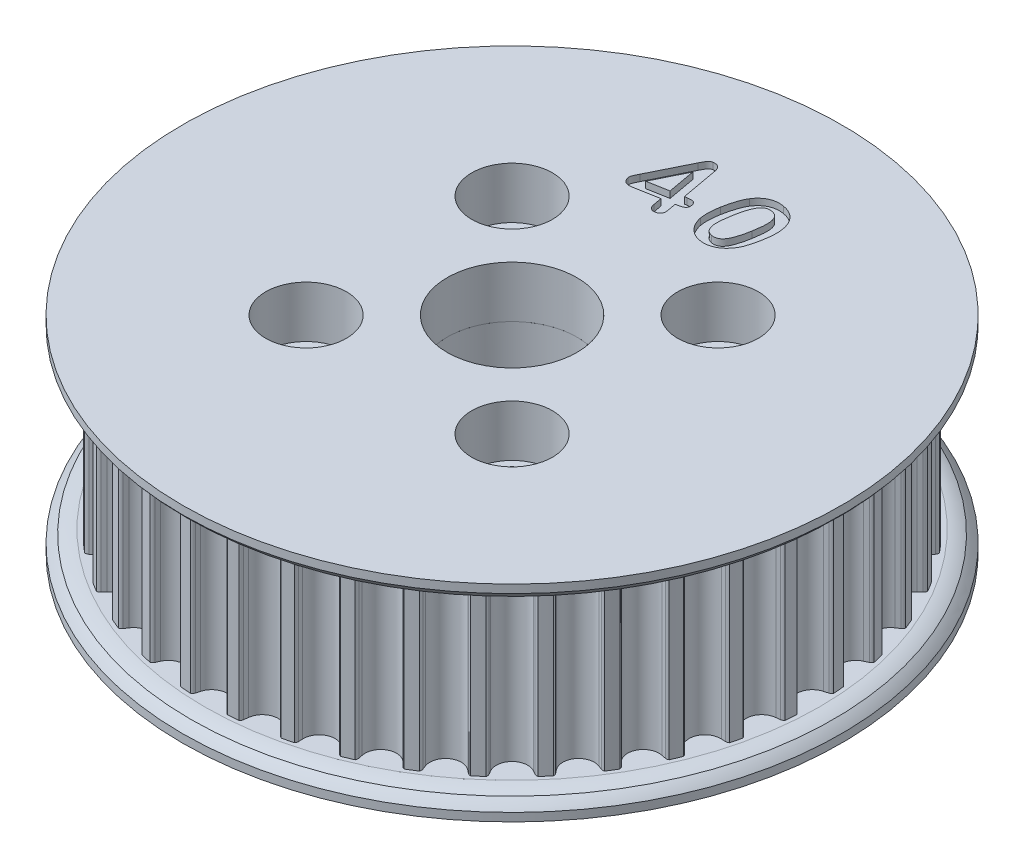
from build123d import *

# Parameters (mm, degrees)
SKETCH1_R                    = 18.717593782
TOOTHOD_DEPTH                = 5.08
TOOTHPROFILE_DEPTH           = 27.953720225
TOOTHPATTERN_COUNT           = 40
LARGE_TOOTH_COUNT_DEPTH      = 32.418064867
LARGE_TOOTH_COUNT_DEPTH_BACK = 0.4
CUT_EXTRUDE1_DEPTH           = 9.525
SKETCH15_R                   = 4
BOSS_EXTRUDE1_DEPTH          = 9.525
SKETCH16_R                   = 4
SKETCH16_R_2                 = 2.4892
CUT_EXTRUDE2_DEPTH           = 32.418064997
SKETCH17_R                   = 2.0193
CUT_EXTRUDE3_DEPTH           = 31.274253635
CIRPATTERN1_START            = -6.35
CIRPATTERN1_OUTLINE_R        = 2.0193
CIRPATTERN1_DEPTH            = 12.7
CIRPATTERN1_START_2          = 3.175
CIRPATTERN1_2_OUTLINE_R      = 2.4892
CIRPATTERN1_2_OUTLINE_R_2    = 2.0193
CIRPATTERN1_2_DEPTH          = 3.175


# Read off the part's stored shape, not the designer's step: CirPattern1
with BuildPart() as part:
    # Sketch1 → ToothOD (new, symmetric)
    with BuildSketch(Plane(origin=(0, 0, 0), x_dir=(1, 0, 0), z_dir=(0, 1, 0))):
        with Locations(Location((0, 0, 0), (0, 0, 270))):
            Circle(SKETCH1_R)
    extrude(amount=TOOTHOD_DEPTH, both=True)

    # Sketch2 → ToothProfile (cut, symmetric)
    with BuildSketch(Plane(origin=(0, 0, 0), x_dir=(1, 0, 0), z_dir=(0, 1, 0))):
        with BuildLine():
            ThreePointArc((-0.937033068, 18.267655778), (-0.590385173, 17.749481168), (0, 17.549193782))
            ThreePointArc((0, 17.549193782), (0.590385173, 17.749481168), (0.937033068, 18.267655778))
            ThreePointArc((0.937033068, 18.267655778), (0.971699064, 18.39376724), (1.007805813, 18.519473782))
            ThreePointArc((1.007805813, 18.519473782), (1.053477193, 18.612017257), (1.127830075, 18.68358414))
            ThreePointArc((1.127830075, 18.68358414), (0, 18.717593782), (-1.127830075, 18.68358414))
            ThreePointArc((-1.127830075, 18.68358414), (-1.053477193, 18.612017257), (-1.007805813, 18.519473782))
            ThreePointArc((-1.007805813, 18.519473782), (-0.971699064, 18.39376724), (-0.937033068, 18.267655778))
        make_face()
    toothprofile = extrude(amount=TOOTHPROFILE_DEPTH, both=True, mode=Mode.SUBTRACT)

    # ToothPattern: ToothProfile ×40 about axis
    toothpattern_axis = Axis((0, 0, 0), (0, 1, 0))
    for i in range(1, TOOTHPATTERN_COUNT):
        add(toothprofile.rotate(toothpattern_axis, i * 360 / TOOTHPATTERN_COUNT), mode=Mode.SUBTRACT)

    # Sketch4 → Flange (revolve)
    with BuildSketch(Plane.XY, mode=Mode.PRIVATE) as flange_sk:
        with BuildLine():
            Line((0, -5.08), (18.971593782, -5.08))
            ThreePointArc((18.971593782, -5.08), (19.402795588, -5.170608766), (19.812, -5.334))
            ThreePointArc((19.812, -5.334), (20.080284982, -5.573715018), (20.32, -5.842))
            Line((20.32, -5.842), (20.32, -6.35))
            Line((20.32, -6.35), (0, -6.35))
            Line((0, -6.35), (0, -5.08))
        make_face()
        with BuildLine():
            Line((20.32, 6.35), (20.32, 5.842))
            ThreePointArc((20.32, 5.842), (20.080284982, 5.573715018), (19.812, 5.334))
            ThreePointArc((19.812, 5.334), (19.402795588, 5.170608766), (18.971593782, 5.08))
            Line((18.971593782, 5.08), (0, 5.08))
            Line((0, 5.08), (0, 6.35))
            Line((0, 6.35), (20.32, 6.35))
        make_face()
    revolve(flange_sk.sketch.rotate(Axis((0, 8.73125, 0), (0, -1, 0)), 90), axis=Axis((0, 8.73125, 0), (0, -1, 0)))

    # Sketch9 → Large Tooth Count (cut, two sides: drawn at the far end of the back side and taken through both)
    # profile 1 of 2: a face of its own
    with BuildSketch(Plane(origin=(0, 6.35, 0), x_dir=(1, 0, 0), z_dir=(0, 1, 0)).offset(-LARGE_TOOTH_COUNT_DEPTH_BACK)):
        with BuildLine():
            Line((-1.531001416, 10.273963423), (-1.62833501, 10.808851704))
            Line((-1.62833501, 10.808851704), (-3.113342041, 10.538282173))
            add(Edge.make_bspline(
                [(-3.113342041, 10.538282173), (-3.157573868, 10.531489763), (-3.240725954, 10.518720609), (-3.360934072, 10.522196405), (-3.467169088, 10.543479268), (-3.559107996, 10.585122259), (-3.634516906, 10.645268103), (-3.693830465, 10.721045004), (-3.73878313, 10.810870646), (-3.753830455, 10.877741788), (-3.761637354, 10.912436079)],
                knots=[0, 0, 0, 0, 1.261064791, 2.370694921, 3.375971367, 4.300849758, 5.191864173, 6.071073382, 6.999228387, 8, 8, 8, 8], degree=3))
            add(Edge.make_bspline(
                [(-3.761637354, 10.912436079), (-3.764103905, 10.931753989), (-3.769109177, 10.970955045), (-3.763805913, 11.032622419), (-3.747957436, 11.09727573), (-3.722649369, 11.164950071), (-3.691299777, 11.233538807), (-3.658266667, 11.30528234), (-3.618789811, 11.38274981), (-3.591055139, 11.437787787), (-3.575899854, 11.467862642)],
                knots=[0, 0, 0, 0, 0.783109992, 1.589133624, 2.47665684, 3.459593021, 4.496192511, 5.515924219, 6.642606049, 8, 8, 8, 8], degree=3))
            Line((-3.575899854, 11.467862642), (-2.390930323, 13.862804829))
            add(Edge.make_bspline(
                [(-2.390930323, 13.862804829), (-2.372748074, 13.899557905), (-2.338615998, 13.968551508), (-2.28677642, 14.063091234), (-2.239840673, 14.142624748), (-2.196501784, 14.208547826), (-2.15133101, 14.262696412), (-2.097029316, 14.301690828), (-2.037496406, 14.332917348), (-1.993600767, 14.342701585), (-1.97123501, 14.34768686)],
                knots=[0, 0, 0, 0, 1.473715082, 2.766487129, 3.87475664, 4.791697709, 5.602923368, 6.390376914, 7.179862975, 8, 8, 8, 8], degree=3))
            add(Edge.make_bspline(
                [(-1.97123501, 14.34768686), (-1.93560088, 14.353037021), (-1.867972069, 14.363190911), (-1.769708494, 14.354811035), (-1.68199654, 14.329147171), (-1.605665982, 14.283144549), (-1.541717762, 14.217459864), (-1.491172292, 14.133016218), (-1.450453439, 14.031118428), (-1.434266071, 13.95571375), (-1.425631104, 13.915489985)],
                knots=[0, 0, 0, 0, 1.082605443, 2.054640314, 2.945534019, 3.814624522, 4.708898043, 5.679607825, 6.762213268, 8, 8, 8, 8], degree=3))
            Line((-1.425631104, 13.915489985), (-1.010400635, 11.629489985))
            Line((-1.010400635, 11.629489985), (-0.882706104, 11.652707173))
            add(Edge.make_bspline(
                [(-0.882706104, 11.652707173), (-0.84646646, 11.658246344), (-0.777505328, 11.668786941), (-0.677916966, 11.676404796), (-0.588147993, 11.670289988), (-0.519297337, 11.659765285), (-0.470070359, 11.643140787), (-0.437049231, 11.625116479), (-0.408455628, 11.600135161), (-0.382124896, 11.570904138), (-0.360969715, 11.53499513), (-0.342050824, 11.494769512), (-0.326744764, 11.448610385), (-0.320069193, 11.415563616), (-0.316563916, 11.398211079)],
                knots=[0, 0, 0, 0, 1.840737212, 3.502775074, 4.999825363, 6.351129362, 6.984428984, 7.599845273, 8.225517707, 8.882017688, 9.566331457, 10.308414656, 11.111765001, 12, 12, 12, 12], degree=3))
            add(Edge.make_bspline(
                [(-0.316563916, 11.398211079), (-0.31271839, 11.370297547), (-0.305432502, 11.317411444), (-0.31301621, 11.240389839), (-0.33847205, 11.172677568), (-0.381769569, 11.11570193), (-0.439999791, 11.067202397), (-0.51461296, 11.028758555), (-0.604290225, 10.99749077), (-0.669967809, 10.983952299), (-0.705005323, 10.976729829)],
                knots=[0, 0, 0, 0, 1.028137069, 1.94794994, 2.799222888, 3.639775233, 4.536155766, 5.549368362, 6.692643156, 8, 8, 8, 8], degree=3))
            Line((-0.705005323, 10.976729829), (-0.88538501, 10.943689985))
            Line((-0.88538501, 10.943689985), (-0.788051416, 10.408801704))
            add(Edge.make_bspline(
                [(-0.788051416, 10.408801704), (-0.782797877, 10.374067106), (-0.772905674, 10.308663248), (-0.775266865, 10.214417579), (-0.792217426, 10.131360198), (-0.826169115, 10.060610598), (-0.873311523, 10.002442935), (-0.932426935, 9.957159943), (-1.001521523, 9.921789728), (-1.053174681, 9.910269083), (-1.080052198, 9.90427436)],
                knots=[0, 0, 0, 0, 1.271644061, 2.394454852, 3.399944268, 4.321867066, 5.211779105, 6.088240817, 7.00522369, 8, 8, 8, 8], degree=3))
            add(Edge.make_bspline(
                [(-1.080052198, 9.90427436), (-1.106784506, 9.900891615), (-1.158481434, 9.89434981), (-1.23544005, 9.901253369), (-1.306595308, 9.92534683), (-1.372157548, 9.964116781), (-1.428789431, 10.019612331), (-1.475181218, 10.090513645), (-1.509705486, 10.176873717), (-1.523631388, 10.240362923), (-1.531001416, 10.273963423)],
                knots=[0, 0, 0, 0, 0.978119839, 1.891560977, 2.781609979, 3.689453249, 4.638753815, 5.63855831, 6.750250241, 8, 8, 8, 8], degree=3))
        make_face()
        Polygon((-3.024938135, 11.263372798), (-1.753350635, 11.494651704), (-2.064996729, 13.209151704), align=None, mode=Mode.SUBTRACT)
    # profile 2 of 2: a face of its own
    with BuildSketch(Plane(origin=(0, 6.35, 0), x_dir=(1, 0, 0), z_dir=(0, 1, 0)).offset(-LARGE_TOOTH_COUNT_DEPTH_BACK)):
        with BuildLine():
            add(Edge.make_bspline(
                [(3.7004625, 11.677153906), (3.686264675, 11.601404519), (3.658870865, 11.455250838), (3.60823368, 11.246398968), (3.555331302, 11.054842095), (3.497140597, 10.879874057), (3.43226392, 10.718370387), (3.354284746, 10.5696501), (3.267863441, 10.429406438), (3.200079147, 10.344222093), (3.166467187, 10.301982031)],
                knots=[0, 0, 0, 0, 1.239292749, 2.391137464, 3.455110319, 4.434576526, 5.35558113, 6.250576262, 7.132519381, 8, 8, 8, 8], degree=3))
            add(Edge.make_bspline(
                [(3.166467187, 10.301982031), (3.144198164, 10.275762567), (3.099982848, 10.223703623), (3.028150759, 10.152099925), (2.955162603, 10.084262728), (2.878202286, 10.023683343), (2.798344121, 9.969152553), (2.716313748, 9.919700373), (2.631008556, 9.876989925), (2.515006197, 9.826838731), (2.364496556, 9.780916237), (2.178286013, 9.751180687), (1.987209688, 9.746705952), (1.860205836, 9.764969839), (1.795760156, 9.7742375)],
                knots=[0, 0, 0, 0, 0.801914036, 1.592206392, 2.363614895, 3.12467816, 3.873679032, 4.617741915, 5.356605588, 6.096739935, 7.563535306, 9.011766561, 10.483677989, 12, 12, 12, 12], degree=3))
            add(Edge.make_bspline(
                [(1.795760156, 9.7742375), (1.758691219, 9.781631242), (1.685306753, 9.796268451), (1.579017325, 9.829261717), (1.47669898, 9.867783469), (1.380044445, 9.916590329), (1.285561627, 9.968935939), (1.19738272, 10.03240735), (1.113160926, 10.102133163), (1.033456371, 10.178910635), (0.960133443, 10.26276729), (0.891273319, 10.351207984), (0.831227587, 10.446296886), (0.776093193, 10.545504009), (0.728929808, 10.650561093), (0.688129265, 10.760416841), (0.652394743, 10.875273666), (0.635471729, 10.954585081), (0.626864062, 10.994925781)],
                knots=[0, 0, 0, 0, 1.006831006, 1.993198655, 2.962670514, 3.917125603, 4.876579595, 5.838523297, 6.807605523, 7.789496056, 8.784377988, 9.774567055, 10.773710418, 11.778570219, 12.797611708, 13.839467994, 14.90107403, 16, 16, 16, 16], degree=3))
            add(Edge.make_bspline(
                [(0.626864062, 10.994925781), (0.619759274, 11.038311971), (0.605309332, 11.126552166), (0.593814246, 11.262326323), (0.586896602, 11.40293425), (0.589152193, 11.548709409), (0.598648225, 11.69935456), (0.612502788, 11.855226338), (0.63412349, 12.015735441), (0.65299437, 12.123994877), (0.662582812, 12.179002344)],
                knots=[0, 0, 0, 0, 0.885671199, 1.801305883, 2.744009489, 3.721842217, 4.73736564, 5.785511931, 6.874801293, 8, 8, 8, 8], degree=3))
            add(Edge.make_bspline(
                [(0.662582812, 12.179002344), (0.67581353, 12.249342885), (0.701685694, 12.38689113), (0.747177039, 12.586095152), (0.796532307, 12.77366033), (0.848666183, 12.949364152), (0.905121765, 13.112699737), (0.967526733, 13.262167279), (1.031048043, 13.399729724), (1.08126072, 13.48342074), (1.105495312, 13.523813281)],
                knots=[0, 0, 0, 0, 1.20660685, 2.359473668, 3.444007557, 4.475997896, 5.44888863, 6.355661217, 7.206378115, 8, 8, 8, 8], degree=3))
            add(Edge.make_bspline(
                [(1.105495312, 13.523813281), (1.126834416, 13.556524286), (1.168832216, 13.62090329), (1.237568178, 13.7114371), (1.311190111, 13.793654963), (1.38803844, 13.868988013), (1.468633631, 13.937022551), (1.552525179, 13.998072286), (1.640742164, 14.051107199), (1.732849104, 14.096474687), (1.827852868, 14.135111111), (1.926359063, 14.164557494), (2.026980006, 14.186607394), (2.130423165, 14.202480291), (2.236825853, 14.208279031), (2.345683237, 14.206147175), (2.457347204, 14.197656756), (2.53193532, 14.185467192), (2.569964062, 14.179252344)],
                knots=[0, 0, 0, 0, 1.092656575, 2.150473306, 3.176936881, 4.178220762, 5.159348138, 6.12565659, 7.078409122, 8.035701623, 8.996177392, 9.944733961, 10.908670395, 11.876915267, 12.869780463, 13.886055898, 14.922205845, 16, 16, 16, 16], degree=3))
            add(Edge.make_bspline(
                [(2.569964062, 14.179252344), (2.619624638, 14.169226826), (2.716840932, 14.14960072), (2.855875094, 14.103943551), (2.985902625, 14.04899947), (3.106389503, 13.982386476), (3.217471903, 13.905565708), (3.318837426, 13.818133593), (3.411769076, 13.721779129), (3.492574376, 13.613505622), (3.565776041, 13.496705298), (3.628707217, 13.369762396), (3.683047683, 13.233001098), (3.710511229, 13.137130565), (3.724572656, 13.088044531)],
                knots=[0, 0, 0, 0, 1.079729077, 2.11369401, 3.114862735, 4.086675933, 5.044705033, 5.990156637, 6.93763101, 7.893743987, 8.866158368, 9.874067695, 10.911515541, 12, 12, 12, 12], degree=3))
            add(Edge.make_bspline(
                [(3.724572656, 13.088044531), (3.735099244, 13.042639356), (3.756896756, 12.948618401), (3.776692586, 12.799831487), (3.786882924, 12.639950564), (3.788716644, 12.468830024), (3.780101474, 12.286771755), (3.762793048, 12.093481855), (3.737219973, 11.888738889), (3.712960493, 11.749095406), (3.7004625, 11.677153906)],
                knots=[0, 0, 0, 0, 0.786691818, 1.629010692, 2.530719007, 3.490774846, 4.517115952, 5.606966069, 6.767157296, 8, 8, 8, 8], degree=3))
        make_face()
        with BuildLine():
            add(Edge.make_bspline(
                [(2.910185156, 11.880750781), (2.924410495, 11.964603932), (2.951486621, 12.124207756), (2.981874031, 12.353435144), (2.998161754, 12.560314022), (3.002720248, 12.745834185), (2.993973814, 12.911553595), (2.969933101, 13.058716639), (2.929909935, 13.187754947), (2.874474497, 13.299155576), (2.801281854, 13.393285072), (2.706839088, 13.465754997), (2.594968943, 13.521017292), (2.511607524, 13.539292631), (2.468165625, 13.548816406)],
                knots=[0, 0, 0, 0, 1.58388521, 3.014724367, 4.304646265, 5.446791372, 6.468588601, 7.390852584, 8.216588302, 8.975197153, 9.697217003, 10.415802656, 11.174431761, 12, 12, 12, 12], degree=3))
            add(Edge.make_bspline(
                [(2.468165625, 13.548816406), (2.436099139, 13.553635955), (2.373958902, 13.562975546), (2.28175461, 13.560981921), (2.19488034, 13.545989423), (2.113334219, 13.517012945), (2.037360483, 13.474327837), (1.967074016, 13.41802768), (1.902473026, 13.348317888), (1.843437621, 13.265140408), (1.789523086, 13.168320816), (1.73651258, 13.059109551), (1.687078599, 12.935681177), (1.639915098, 12.798842122), (1.595270597, 12.648373065), (1.553834599, 12.483761428), (1.513386631, 12.30550906), (1.489963339, 12.181465967), (1.477863281, 12.1173875)],
                knots=[0, 0, 0, 0, 0.799431854, 1.549183897, 2.265673805, 2.967656902, 3.675043338, 4.407302646, 5.182031398, 6.014136202, 6.91929923, 7.915230763, 9.009728297, 10.199692224, 11.487861376, 12.88351287, 14.390077883, 16, 16, 16, 16], degree=3))
            add(Edge.make_bspline(
                [(1.477863281, 12.1173875), (1.469909645, 12.073370146), (1.454350245, 11.987260657), (1.435180844, 11.860614905), (1.417742779, 11.739855671), (1.404360242, 11.62491711), (1.39461089, 11.515612691), (1.387442469, 11.412010626), (1.382646763, 11.314060687), (1.381493996, 11.194285407), (1.387489531, 11.056488406), (1.412169879, 10.905691302), (1.451053834, 10.773132799), (1.5049595, 10.658369923), (1.577720936, 10.562545304), (1.669426393, 10.488079638), (1.778682067, 10.432487804), (1.859764301, 10.414203177), (1.902023437, 10.404673438)],
                knots=[0, 0, 0, 0, 1.091371878, 2.135009643, 3.125165946, 4.06839428, 4.95806396, 5.802562953, 6.602308193, 7.350423399, 8.725033855, 9.962033809, 11.0695267, 12.086256579, 13.039221506, 13.978470784, 14.946402002, 16, 16, 16, 16], degree=3))
            add(Edge.make_bspline(
                [(1.902023437, 10.404673438), (1.924587882, 10.400887995), (1.968620661, 10.393500995), (2.034218783, 10.391230619), (2.097039875, 10.394553102), (2.157236001, 10.404407116), (2.214533549, 10.420356358), (2.269153619, 10.443080638), (2.320855396, 10.472717028), (2.387733076, 10.521499558), (2.464921351, 10.599186031), (2.548360565, 10.711042387), (2.622168921, 10.845258606), (2.675987846, 10.971459008), (2.716902488, 11.083645194), (2.746809929, 11.177012017), (2.776420898, 11.277314053), (2.804882222, 11.384536629), (2.832457187, 11.498592767), (2.859088379, 11.619852486), (2.886241044, 11.747671693), (2.902089886, 11.835758045), (2.910185156, 11.880750781)],
                knots=[0, 0, 0, 0, 0.687381122, 1.341371444, 1.968978725, 2.576739265, 3.171843679, 3.753672719, 4.350994545, 4.959743046, 6.238357749, 7.625796228, 9.144683334, 10.832503885, 11.74714998, 12.735073917, 13.780221821, 14.891903747, 16.070782631, 17.308674638, 18.625325182, 20, 20, 20, 20], degree=3))
        make_face(mode=Mode.SUBTRACT)
    extrude(amount=LARGE_TOOTH_COUNT_DEPTH + LARGE_TOOTH_COUNT_DEPTH_BACK, mode=Mode.SUBTRACT)

    # Sketch14 → Cut-Extrude1 (cut)
    with BuildSketch(Plane.XZ.offset(6.35)):
        with BuildLine():
            Line((-4.7625, -11.1125), (4.7625, -11.1125))
            ThreePointArc((4.7625, -11.1125), (9.252628061, -9.252628061), (11.1125, -4.7625))
            Line((11.1125, -4.7625), (11.1125, 4.7625))
            ThreePointArc((11.1125, 4.7625), (9.252628061, 9.252628061), (4.7625, 11.1125))
            Line((4.7625, 11.1125), (-4.7625, 11.1125))
            ThreePointArc((-4.7625, 11.1125), (-9.252628061, 9.252628061), (-11.1125, 4.7625))
            Line((-11.1125, 4.7625), (-11.1125, -4.7625))
            ThreePointArc((-11.1125, -4.7625), (-9.252628061, -9.252628061), (-4.7625, -11.1125))
        make_face()
    extrude(amount=-CUT_EXTRUDE1_DEPTH, mode=Mode.SUBTRACT)

    # Sketch16 → Cut-Extrude2 (cut, through all)
    with BuildSketch(Plane(origin=(0, 6.35, 0), x_dir=(1, 0, 0), z_dir=(0, 1, 0))):
        with Locations(Location((0, 0, 0), (0, 0, 270))):
            Circle(SKETCH16_R)
        with Locations(Location((6.35, -6.35, 0), (0, 0, 270))):
            Circle(SKETCH16_R_2)
    extrude(amount=-CUT_EXTRUDE2_DEPTH, mode=Mode.SUBTRACT)


with BuildPart() as body_2:
    # Sketch15 → Boss-Extrude1 (new body)
    with BuildSketch(Plane.XZ.offset(-3.175)):
        with BuildLine():
            Line((11.1125, -4.7625), (11.1125, 4.7625))
            ThreePointArc((11.1125, 4.7625), (9.252628061, 9.252628061), (4.7625, 11.1125))
            Line((4.7625, 11.1125), (-4.7625, 11.1125))
            ThreePointArc((-4.7625, 11.1125), (-9.252628061, 9.252628061), (-11.1125, 4.7625))
            Line((-11.1125, 4.7625), (-11.1125, -4.7625))
            ThreePointArc((-11.1125, -4.7625), (-9.252628061, -9.252628061), (-4.7625, -11.1125))
            Line((-4.7625, -11.1125), (4.7625, -11.1125))
            ThreePointArc((4.7625, -11.1125), (9.252628061, -9.252628061), (11.1125, -4.7625))
        make_face()
        with Locations(Location((0, 0, 0), (0, 0, 90))):
            Circle(SKETCH15_R, mode=Mode.SUBTRACT)
    extrude(amount=BOSS_EXTRUDE1_DEPTH)

    # Sketch17 → Cut-Extrude3 (cut, through all)
    with BuildSketch(Plane(origin=(0, 3.175, 0), x_dir=(1, 0, 0), z_dir=(0, 1, 0))):
        with Locations(Location((6.35, -6.35, 0), (0, 0, 270))):
            Circle(SKETCH17_R)
    extrude(amount=-CUT_EXTRUDE3_DEPTH, mode=Mode.SUBTRACT)


with BuildPart() as cirpattern1_tool:
    # CirPattern1 outline → CirPattern1 (new body)
    with BuildSketch(Plane(origin=(0, 0, 0), x_dir=(1, 0, 0), z_dir=(0, 1, 0)).offset(CIRPATTERN1_START)):
        with Locations((6.35, 6.35)):
            Circle(CIRPATTERN1_OUTLINE_R)
        with Locations((-6.35, 6.35)):
            Circle(CIRPATTERN1_OUTLINE_R)
        with Locations((-6.35, -6.35)):
            Circle(CIRPATTERN1_OUTLINE_R)
    extrude(amount=CIRPATTERN1_DEPTH)


with BuildPart() as part_1:
    add(part.part)

    # CirPattern1: cut by cirpattern1_tool
    add(cirpattern1_tool.part, mode=Mode.SUBTRACT)

    # CirPattern1 2 outline → CirPattern1 2 (cut)
    # profile 1 of 3: a face of its own
    with BuildSketch(Plane(origin=(0, 0, 0), x_dir=(1, 0, 0), z_dir=(0, 1, 0)).offset(CIRPATTERN1_START_2)):
        with Locations((6.35, 6.35)):
            Circle(CIRPATTERN1_2_OUTLINE_R)
        with Locations((6.35, 6.35)):
            Circle(CIRPATTERN1_2_OUTLINE_R_2, mode=Mode.SUBTRACT)
    # profile 2 of 3: a face of its own
    with BuildSketch(Plane(origin=(0, 0, 0), x_dir=(1, 0, 0), z_dir=(0, 1, 0)).offset(CIRPATTERN1_START_2)):
        with Locations((-6.35, 6.35)):
            Circle(CIRPATTERN1_2_OUTLINE_R)
        with Locations((-6.35, 6.35)):
            Circle(CIRPATTERN1_2_OUTLINE_R_2, mode=Mode.SUBTRACT)
    # profile 3 of 3: a face of its own
    with BuildSketch(Plane(origin=(0, 0, 0), x_dir=(1, 0, 0), z_dir=(0, 1, 0)).offset(CIRPATTERN1_START_2)):
        with Locations((-6.35, -6.35)):
            Circle(CIRPATTERN1_2_OUTLINE_R)
        with Locations((-6.35, -6.35)):
            Circle(CIRPATTERN1_2_OUTLINE_R_2, mode=Mode.SUBTRACT)
    extrude(amount=CIRPATTERN1_2_DEPTH, mode=Mode.SUBTRACT)


with BuildPart() as body_2_1:
    add(body_2.part)

    # CirPattern1: cut by cirpattern1_tool
    add(cirpattern1_tool.part, mode=Mode.SUBTRACT)


solid = Compound([part_1.part, body_2_1.part])
